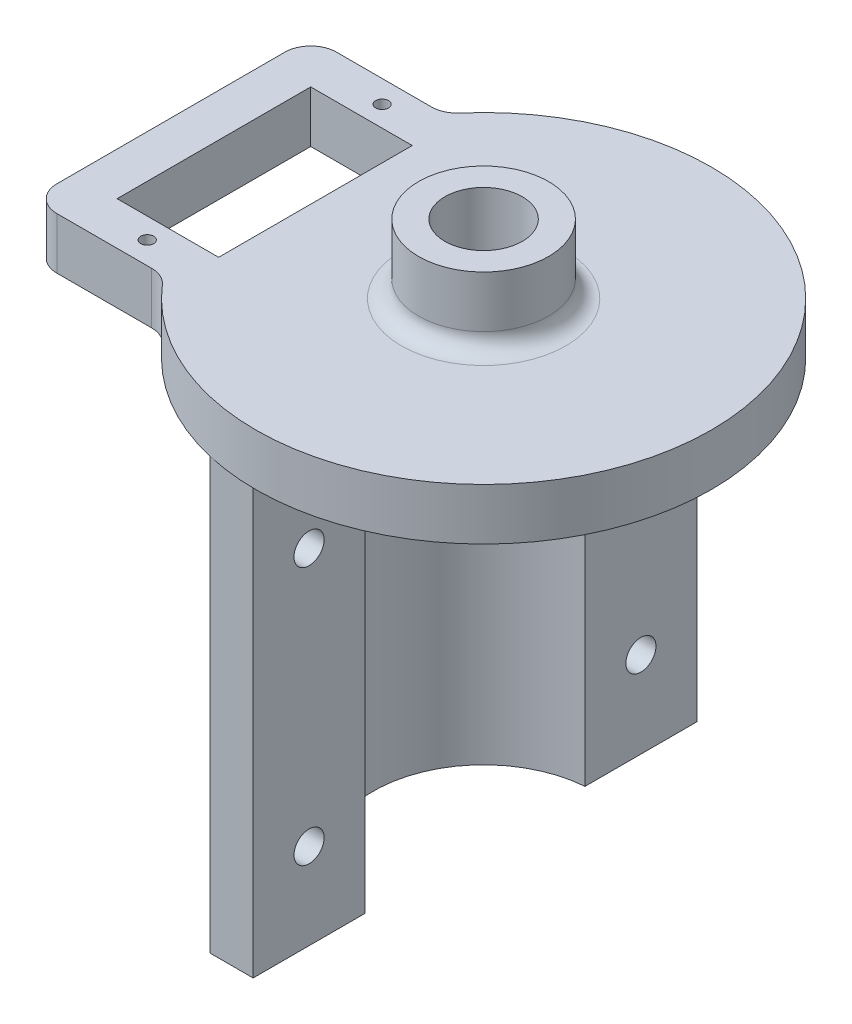
from build123d import *

# Parameters (mm, degrees)
BOSS_EXTRUDE4_DEPTH = 50
SKETCH7_R           = 1.75
CUT_EXTRUDE1_DEPTH  = 59.719147195
SKETCH8_R           = 0.75
SKETCH8_W           = 11.8
SKETCH8_H           = 22.5
BOSS_EXTRUDE5_DEPTH = 6
SKETCH9_R           = 7.55
BOSS_EXTRUDE6_DEPTH = 8
FILLET1_R           = 2
SKETCH10_R          = 4.5
CUT_EXTRUDE2_DEPTH  = 79.215829027


with BuildPart() as part:
    # Sketch6 → Boss-Extrude4 (new body)
    with BuildSketch(Plane.XZ):
        with BuildLine():
            Line((-1, 25.784833184), (-1, 12.785954208))
            ThreePointArc((-1, 12.785954208), (-12.825, 0), (-1, -12.785954208))
            Line((-1, -12.785954208), (-1, -25.784833184))
            Line((-1, -25.784833184), (-6, -25.784833184))
            Line((-6, -25.784833184), (-6, -16.784833184))
            ThreePointArc((-6, -16.784833184), (-17.825, 0), (-6, 16.784833184))
            Line((-6, 16.784833184), (-6, 25.784833184))
            Line((-6, 25.784833184), (-1, 25.784833184))
        make_face()
    extrude(amount=BOSS_EXTRUDE4_DEPTH)

    # Sketch7 → Cut-Extrude1 (cut, through all)
    with BuildSketch(Plane(origin=(-1, 0, 0), x_dir=(0, 0, -1), z_dir=(1, 0, 0))):
        with Locations((-19.285393696, -10)):
            Circle(SKETCH7_R)
        with Locations((-19.285393696, -40)):
            Circle(SKETCH7_R)
        with Locations((19.285393696, -40)):
            Circle(SKETCH7_R)
        with Locations((19.285393696, -10)):
            Circle(SKETCH7_R)
    extrude(amount=-CUT_EXTRUDE1_DEPTH, mode=Mode.SUBTRACT)

    # Sketch8 → Boss-Extrude5 (add)
    with BuildSketch(Plane(origin=(0, 0, 0), x_dir=(1, 0, 0), z_dir=(0, 1, 0))):
        with BuildLine():
            Line((-33.34361413, -16.25), (-22.318992281, -16.25))
            ThreePointArc((-22.318992281, -16.25), (-21.069616181, -16.522536094), (-20.047240136, -17.290627093))
            ThreePointArc((-20.047240136, -17.290627093), (26.473715688, 0), (-20.047240136, 17.290627093))
            ThreePointArc((-20.047240136, 17.290627093), (-21.069616181, 16.522536094), (-22.318992281, 16.25))
            Line((-22.318992281, 16.25), (-33.34361413, 16.25))
            ThreePointArc((-33.34361413, 16.25), (-35.464934474, 15.371320344), (-36.34361413, 13.25))
            Line((-36.34361413, 13.25), (-36.34361413, -13.25))
            ThreePointArc((-36.34361413, -13.25), (-35.464934474, -15.371320344), (-33.34361413, -16.25))
        make_face()
        with Locations((-25.44361413, 13.65)):
            Circle(SKETCH8_R, mode=Mode.SUBTRACT)
        with Locations((-25.44361413, -13.65)):
            Circle(SKETCH8_R, mode=Mode.SUBTRACT)
        with Locations((-25.44361413, 0)):
            Rectangle(SKETCH8_W, SKETCH8_H, mode=Mode.SUBTRACT)
    extrude(amount=BOSS_EXTRUDE5_DEPTH)

    # Sketch9 → Boss-Extrude6 (add)
    with BuildSketch(Plane(origin=(0, 6, 0), x_dir=(1, 0, 0), z_dir=(0, 1, 0))):
        Circle(SKETCH9_R)
    extrude(amount=BOSS_EXTRUDE6_DEPTH)

    # Fillet1
    fillet1_edges = [part.edges().sort_by_distance(p)[0] for p in [
        (-7.55, 6, 0),
    ]]
    fillet(fillet1_edges, radius=FILLET1_R)

    # Sketch10 → Cut-Extrude2 (cut, through all)
    with BuildSketch(Plane(origin=(0, 14, 0), x_dir=(1, 0, 0), z_dir=(0, 1, 0))):
        Circle(SKETCH10_R)
    extrude(amount=-CUT_EXTRUDE2_DEPTH, mode=Mode.SUBTRACT)


solid = part.part
